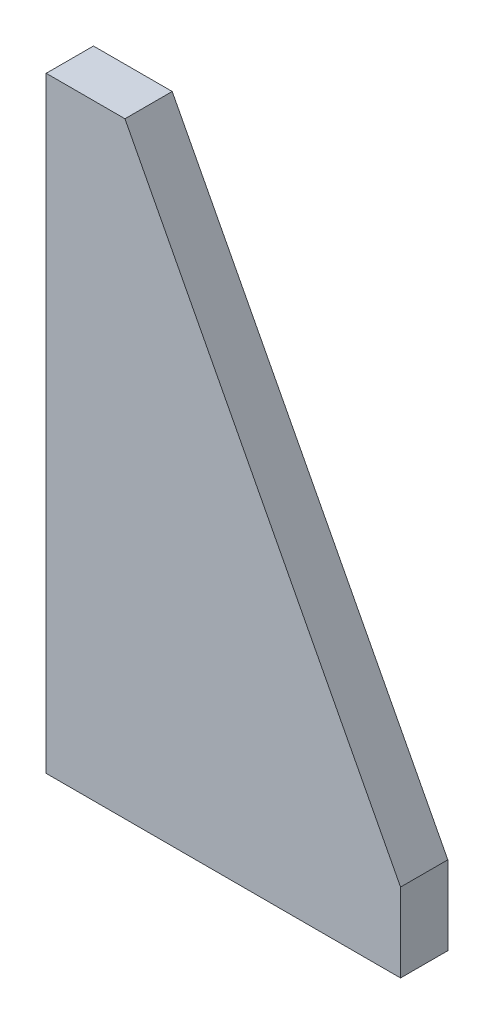
from build123d import *

# Parameters (mm, degrees)
EXTRUDE_1_DEPTH = 3


with BuildPart() as part:
    # Sketch 1 → Бобышка-Вытянуть1 (new, symmetric)
    with BuildSketch(Plane.XY):
        Polygon((45, 0), (0, 0), (0, 77), (10, 77), (45, 10), align=None)
    extrude(amount=EXTRUDE_1_DEPTH, both=True)


solid = part.part
